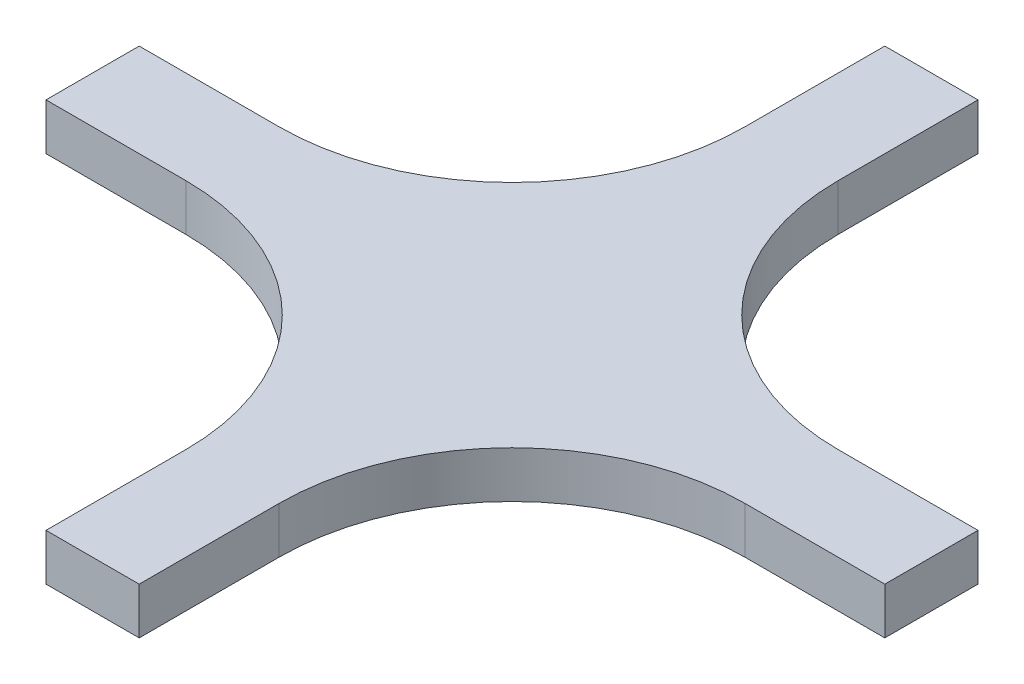
from build123d import *

# Parameters (mm, degrees)
BOSS_EXTRUDE1_DEPTH = 25.4


with BuildPart() as part:
    # Sketch1 → Boss-Extrude1 (new body)
    with BuildSketch(Plane(origin=(0, 0, 0), x_dir=(1, 0, 0), z_dir=(0, 1, 0))):
        with BuildLine():
            Line((-152.4, 25.4), (-228.6, 25.4))
            Line((-228.6, 25.4), (-228.6, -25.4))
            Line((-228.6, -25.4), (-152.4, -25.4))
            ThreePointArc((-152.4, -25.4), (-62.597438789, -62.597438789), (-25.4, -152.4))
            Line((-25.4, -152.4), (-25.4, -228.6))
            Line((-25.4, -228.6), (25.4, -228.6))
            Line((25.4, -228.6), (25.4, -152.4))
            ThreePointArc((25.4, -152.4), (62.597438789, -62.597438789), (152.4, -25.4))
            Line((152.4, -25.4), (228.6, -25.4))
            Line((228.6, -25.4), (228.6, 25.4))
            Line((228.6, 25.4), (152.4, 25.4))
            ThreePointArc((152.4, 25.4), (62.597438789, 62.597438789), (25.4, 152.4))
            Line((25.4, 152.4), (25.4, 228.6))
            Line((25.4, 228.6), (-25.4, 228.6))
            Line((-25.4, 228.6), (-25.4, 152.4))
            ThreePointArc((-25.4, 152.4), (-62.597438789, 62.597438789), (-152.4, 25.4))
        make_face()
    extrude(amount=BOSS_EXTRUDE1_DEPTH)


solid = part.part
